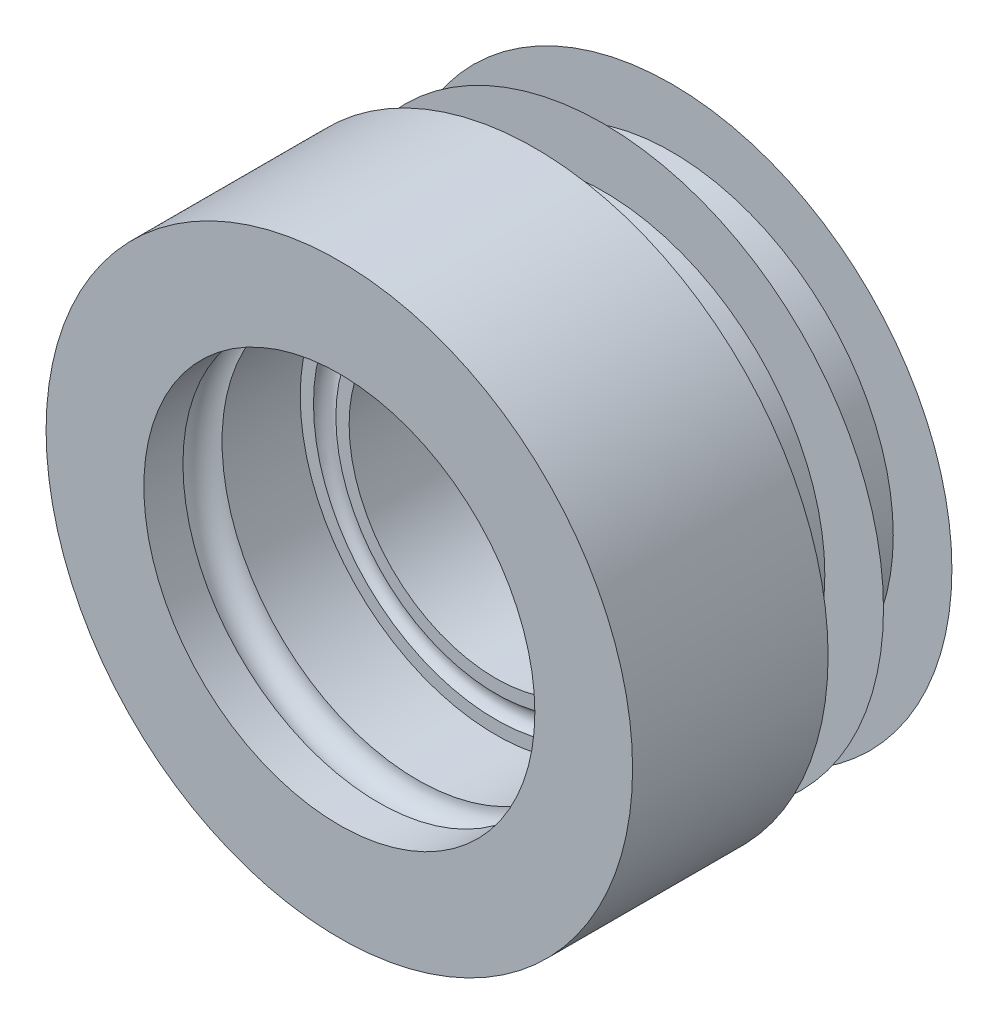
from build123d import *

# Parameters (mm, degrees)
SKETCH1_R           = 15
BOSS_EXTRUDE1_DEPTH = 10
SKETCH2_R           = 10
CUT_EXTRUDE1_DEPTH  = 24.452078799
SKETCH3_R           = 1
SKETCH5_W           = 11
SKETCH5_H           = 3.5
SKETCH7_R           = 0.625
SKETCH9_R           = 11.332657873
BOSS_EXTRUDE2_DEPTH = 9
SKETCH10_R          = 7.5
CUT_EXTRUDE2_DEPTH  = 29.478061732
LPATTERN1_COUNT     = 3
LPATTERN1_PITCH     = 3.5


with BuildPart() as part:
    # Sketch1 → Boss-Extrude1 (new body)
    with BuildSketch(Plane.XY):
        Circle(SKETCH1_R)
    extrude(amount=BOSS_EXTRUDE1_DEPTH)

    # Sketch2 → Cut-Extrude1 (cut, through all)
    with BuildSketch(Plane.XY.offset(10)):
        Circle(SKETCH2_R)
    extrude(amount=-CUT_EXTRUDE1_DEPTH, mode=Mode.SUBTRACT)

    # Sketch3 → Cut-Revolve2 (revolve, cut)
    with BuildSketch(Plane(origin=(0, 0, 0), x_dir=(0, 0, -1), z_dir=(1, 0, 0))):
        with Locations((-7, 10)):
            Circle(SKETCH3_R)
    revolve(axis=Axis((0, 0, 0), (0, 0, 1)), mode=Mode.SUBTRACT)

    # Sketch5 → Revolve1 (revolve)
    with BuildSketch(Plane(origin=(0, 0, 0), x_dir=(0, 0, -1), z_dir=(1, 0, 0))):
        with Locations((3.5, -9.25)):
            Rectangle(SKETCH5_W, SKETCH5_H)
    revolve(axis=Axis((0, 0, 0), (0, 0, 1)))

    # Sketch7 → Cut-Revolve3 (revolve, cut)
    with BuildSketch(Plane(origin=(0, 0, 0), x_dir=(0, 0, -1), z_dir=(1, 0, 0))):
        with Locations((-2.25, 8.75)):
            Circle(SKETCH7_R)
    revolve(axis=Axis((0, 0, 0), (0, 0, 1)), mode=Mode.SUBTRACT)

    # Sketch9 → Boss-Extrude2 (add)
    with BuildSketch(Plane(origin=(0, 0, 0), x_dir=(-1, 0, 0), z_dir=(0, 0, -1))):
        Circle(SKETCH9_R)
    extrude(amount=BOSS_EXTRUDE2_DEPTH)

    # Sketch10 → Cut-Extrude2 (cut, through all)
    with BuildSketch(Plane(origin=(0, 0, -9), x_dir=(-1, 0, 0), z_dir=(0, 0, -1))):
        Circle(SKETCH10_R)
    extrude(amount=-CUT_EXTRUDE2_DEPTH, mode=Mode.SUBTRACT)

    # Sketch11 → Revolve2 (revolve)
    with BuildSketch(Plane(origin=(0, 0, 0), x_dir=(0, 0, -1), z_dir=(1, 0, 0))):
        Polygon((9, 11.332657873), (7, 11.332657873), (7, 14.332657873), align=None)
    revolve2 = revolve(axis=Axis((0, 0, 0), (0, 0, 1)))

    # LPattern1: Revolve2 ×3
    with Locations(*[(0, 0, i * LPATTERN1_PITCH) for i in range(1, LPATTERN1_COUNT)]):
        add(revolve2)


solid = part.part
